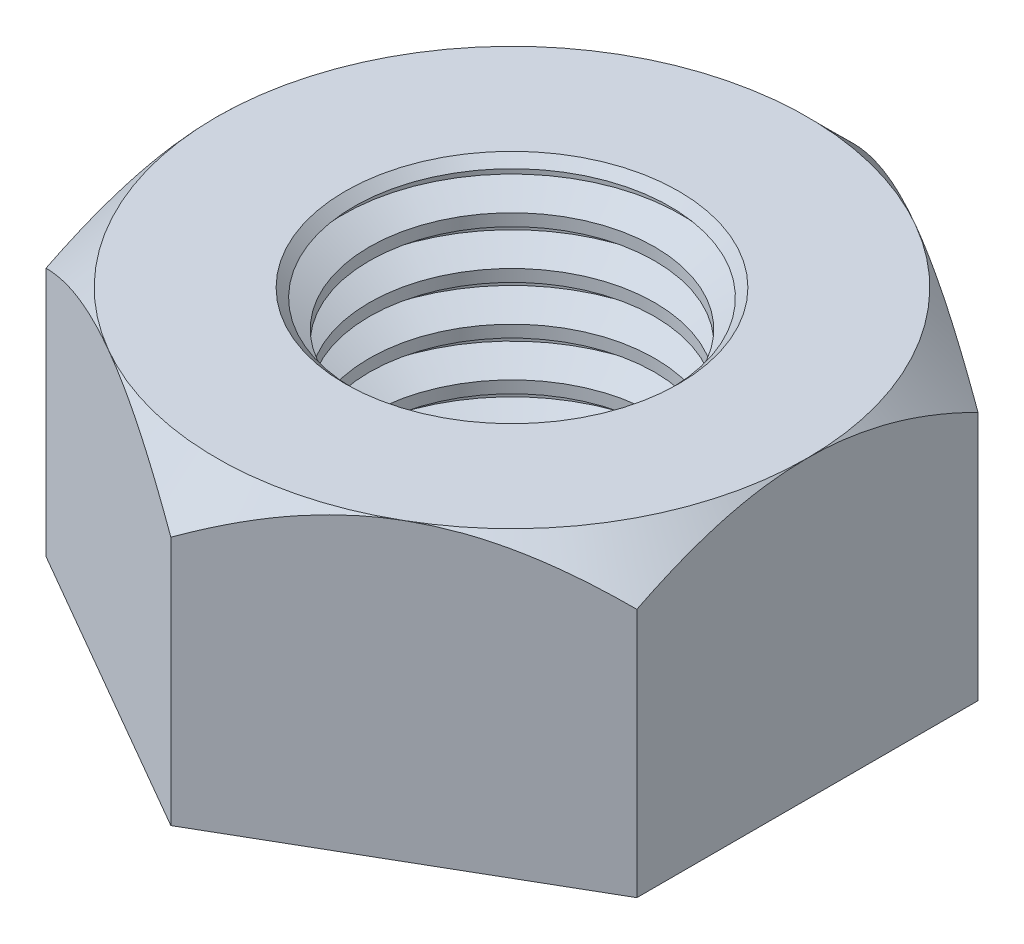
from build123d import *

# Parameters (mm, degrees)
EXTRUDE1_DEPTH  = 5.55625
LPATTERN2_COUNT = 7
LPATTERN2_PITCH = 0.907142857
CHAMFER1_SIZE   = 0.453571429
CHAMFER1_SIZE_2 = 0.332037331


with BuildPart() as part:
    # Sketch1 → Extrude1 (new body)
    with BuildSketch(Plane(origin=(0, 0, 0), x_dir=(1, 0, 0), z_dir=(0, 1, 0))):
        Polygon((0, 6.415804866), (-5.55625, 3.207902433), (-5.55625, -3.207902433), (0, -6.415804866), (5.55625, -3.207902433), (5.55625, 3.207902433), align=None)
    extrude(amount=EXTRUDE1_DEPTH)

    # Sketch3 → Cut-Revolve2 (revolve, cut)
    with BuildSketch(Plane(origin=(0, 0, 0), x_dir=(0, 0, -1), z_dir=(1, 0, 0))):
        Polygon((5.55625, 5.55625), (6.415804866, 4.696695134), (6.415804866, 5.55625), align=None)
    revolve(axis=Axis((0, 0.541995889, 0), (0, -1, 0)), mode=Mode.SUBTRACT)

    # Sketch2 → Cut-Revolve1 (revolve, cut)
    with BuildSketch(Plane.XY, mode=Mode.PRIVATE) as cut_revolve1_sk:
        Polygon((0, 5.55625), (2.683994526, 5.55625), (3.175, 5.272767857), (3.175, 5.159375), (2.683994526, 4.875892857), (2.683994526, 4.649107143), (0, 4.649107143), align=None)
    cut_revolve1 = revolve(cut_revolve1_sk.sketch.rotate(Axis((0, 1.663578541, 0), (0, -1, 0)), 90), axis=Axis((0, 1.663578541, 0), (0, -1, 0)), mode=Mode.SUBTRACT)

    # LPattern2: Cut-Revolve1 ×7
    with Locations(*[(0, -i * LPATTERN2_PITCH, 0) for i in range(1, LPATTERN2_COUNT)]):
        add(cut_revolve1, mode=Mode.SUBTRACT)

    # Chamfer1
    # the kernel refuses this chamfer: 0.453571429, 0.332037331 mm, written as the material it takes off along each edge
    with BuildSketch(Plane(origin=(0, 5.55625, 0), x_dir=(0, 0, 1), z_dir=(1, 0, 0))) as chamfer1_piece_1:
        Polygon((2.683994526 + CHAMFER1_SIZE, 0), (2.683994526 + CHAMFER1_SIZE_2 * 0.866025402678, CHAMFER1_SIZE_2 * 0.499999999361), (2.683994526, 0), align=None)
    revolve(axis=Axis((0, 5.55625, 0), (0, -1, 0)), mode=Mode.SUBTRACT)


solid = part.part
